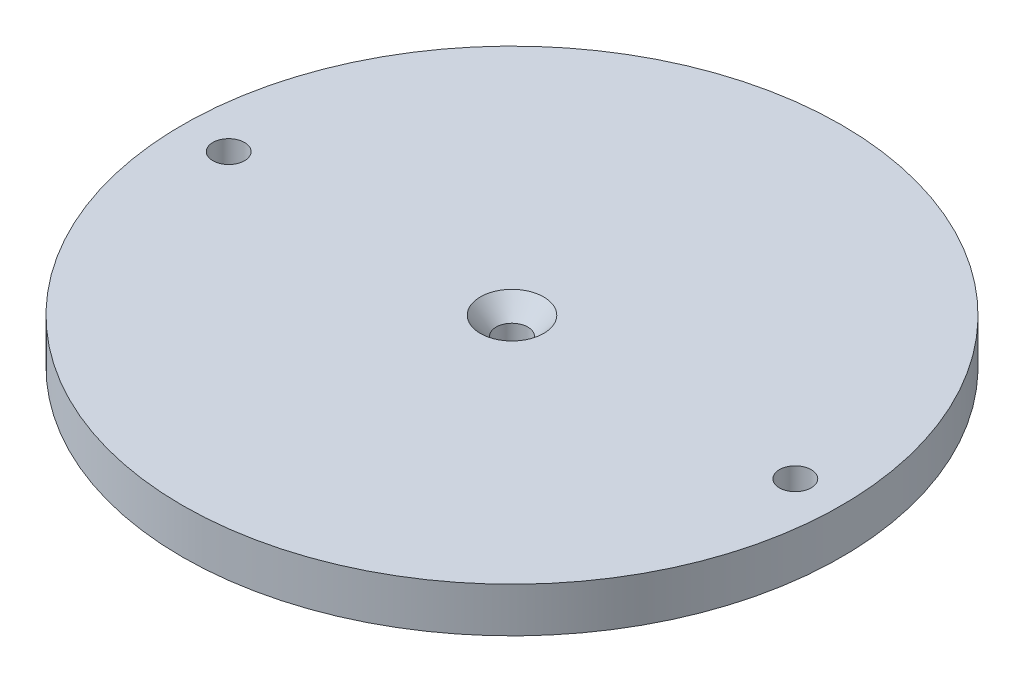
from build123d import *

# Parameters (mm, degrees)
SKETCH2_R                                        = 70.1675
BOSS_EXTRUDE1_DEPTH                              = 9.525
F_1_4_CLEARANCE_HOLE1_D                          = 6.7564
CSK_FOR_1_4_FLAT_HEAD_MACHINE_SCREW1_D           = 6.7564
CSK_FOR_1_4_FLAT_HEAD_MACHINE_SCREW1_CSINK_D     = 13.4874
CSK_FOR_1_4_FLAT_HEAD_MACHINE_SCREW1_CSINK_ANGLE = 82


with BuildPart() as part:
    # Sketch2 → Boss-Extrude1 (new body)
    with BuildSketch(Plane(origin=(0, 0, 0), x_dir=(1, 0, 0), z_dir=(0, 1, 0))):
        Circle(SKETCH2_R)
    extrude(amount=BOSS_EXTRUDE1_DEPTH)

    # 1/4 Clearance Hole1 (through all)
    with Locations(Plane(origin=(0, 9.525, 0), x_dir=(1, 0, 0), z_dir=(0, 1, 0))):
        with Locations((-60.325, 0), (60.325, 0)):
            Hole(F_1_4_CLEARANCE_HOLE1_D / 2)

    # CSK for 1/4 Flat Head Machine Screw1 (through all)
    with Locations(Plane(origin=(0, 9.525, 0), x_dir=(1, 0, 0), z_dir=(0, 1, 0))):
        with Locations((0, 0)):
            CounterSinkHole(CSK_FOR_1_4_FLAT_HEAD_MACHINE_SCREW1_D / 2, CSK_FOR_1_4_FLAT_HEAD_MACHINE_SCREW1_CSINK_D / 2, counter_sink_angle=CSK_FOR_1_4_FLAT_HEAD_MACHINE_SCREW1_CSINK_ANGLE)


solid = part.part
